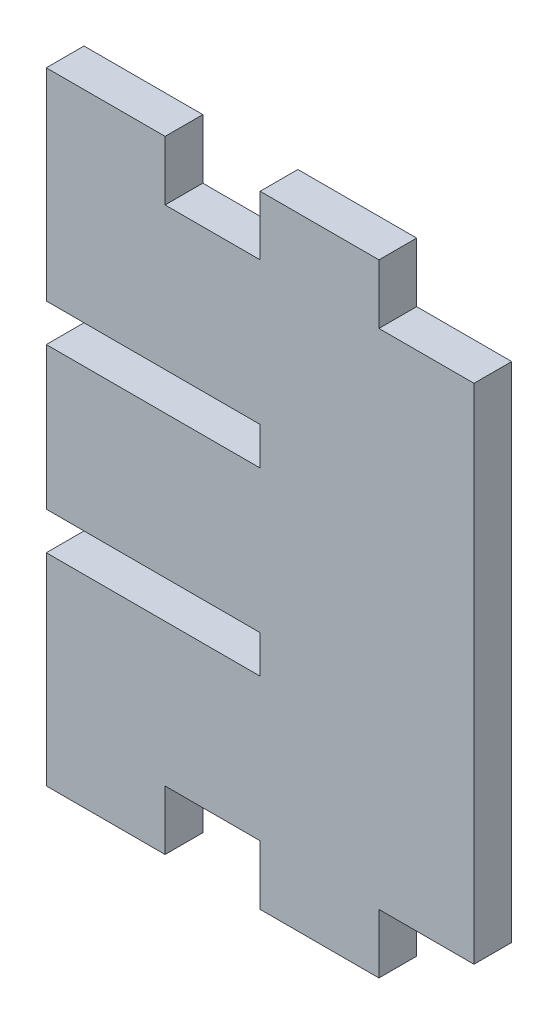
from build123d import *

# Parameters (mm, degrees)
BOSS_EXTRUDE2_DEPTH = 3.175


with BuildPart() as part:
    # Sketch1 → Boss-Extrude2 (new body)
    with BuildSketch(Plane.XY):
        Polygon((-18, 6), (-18, -6), (0, -6), (0, -9.175), (-18, -9.175), (-18, -26.175), (-8, -26.175), (-8, -21.175), (0, -21.175), (0, -26.175), (10, -26.175), (10, -21.175), (18, -21.175), (18, 21.175), (10, 21.175), (10, 26.175), (0, 26.175), (0, 21.175), (-8, 21.175), (-8, 26.175), (-18, 26.175), (-18, 9.175), (0, 9.175), (0, 6), align=None)
    extrude(amount=BOSS_EXTRUDE2_DEPTH)


solid = part.part
